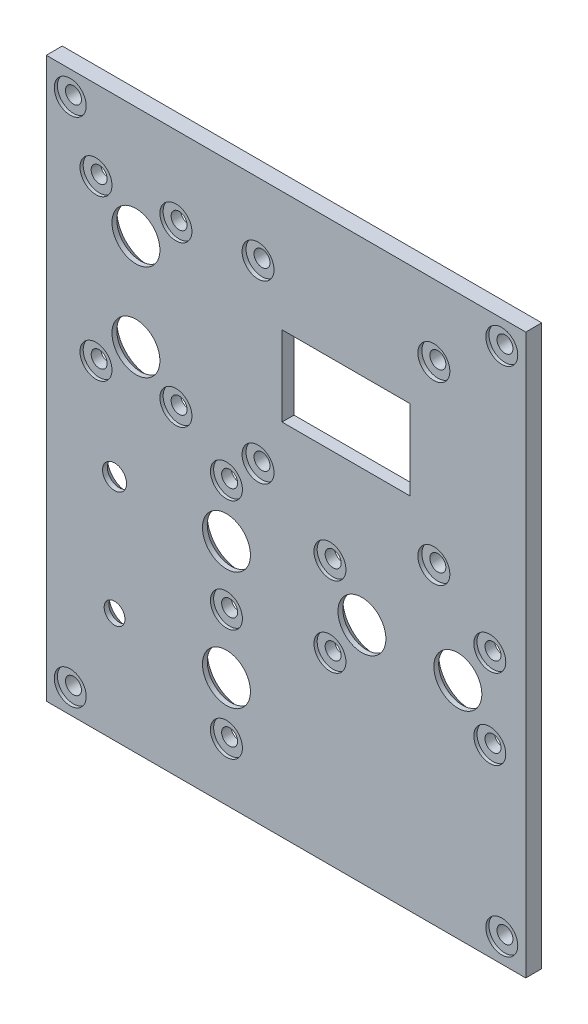
from build123d import *

# Parameters (mm, degrees)
Y_KSEKLIK_EKSTR_ZYON2_DEPTH      = 2
KES_EKSTR_ZYON3_DEPTH            = 2
IZIM3_5_W                        = 16
IZIM3_5_H                        = 10
KES_EKSTR_ZYON6_DEPTH            = 0.5
IZIM3_6_R                        = 1
KES_EKSTR_ZYON7_DEPTH            = 2
OLED_EKRAN_VIDA_R                = 2
KES_EKSTR_ZYON8_DEPTH            = 0.5
KES_EKSTR_ZYON16_DEPTH           = 89.481636513
KES_EKSTR_ZYON16_DEPTH_BACK      = 2
TUS_TAK_M_R                      = 3
TUS_TAK_M_R_2                    = 1
IZIM21_W                         = 23
IZIM21_H                         = 13
IZIM21_R                         = 1
IZIM21_R_2                       = 3
KES_EKSTR_ZYON17_DEPTH           = 0.4
KES_EKSTR_ZYON17_DRAFT           = 20
IZIM21_W_2                       = 13
IZIM21_H_2                       = 23
KES_EKSTR_ZYON17_PROFILE_2_DEPTH = 0.4
KES_EKSTR_ZYON17_PROFILE_2_DRAFT = 20
TUS_TAK_M_9_R                    = 2
TUS_TAK_M_9_R_2                  = 1
KES_EKSTR_ZYON18_DEPTH           = 0.4
POTANSIYOMETRE_TUS_R             = 3
POTANSIYOMETRE_TUS_R_2           = 1.5
POTANSIYOMETRE_TUS_R_3           = 1.300820531
POTANSIYOMETRE_TUS_R_4           = 1
KES_EKSTR_ZYON19_DEPTH           = 2
POTANSIYOMETRE_TUS_3_R           = 2
POTANSIYOMETRE_TUS_3_R_2         = 1
KES_EKSTR_ZYON20_DEPTH           = 0.4
IZIM24_W                         = 16
IZIM24_H                         = 32
IZIM24_R                         = 1
IZIM24_R_2                       = 3
KES_EKSTR_ZYON21_DEPTH           = 0.4
KES_EKSTR_ZYON21_DRAFT           = 20
IZIM24_R_3                       = 5
IZIM24_R_4                       = 1.5
KES_EKSTR_ZYON21_PROFILE_2_DEPTH = 0.4
KES_EKSTR_ZYON21_PROFILE_2_DRAFT = 20
IZIM24_R_5                       = 1.300820531
KES_EKSTR_ZYON21_PROFILE_3_DEPTH = 0.4
KES_EKSTR_ZYON21_PROFILE_3_DRAFT = 20
SASE_VIDA_R                      = 1
KES_EKSTR_ZYON22_DEPTH           = 2
SASE_VIDA_3_R                    = 2
SASE_VIDA_3_R_2                  = 1
KES_EKSTR_ZYON23_DEPTH           = 0.4
RADYUS3_SIZE                     = 1


with BuildPart() as part:
    # genel_sase → Yükseklik-Ekstrüzyon2 (new body)
    with BuildSketch(Plane.XY):
        Polygon((0, 0), (0, 65), (60, 65), (60, -2), (60, -5), (0, -5), align=None)
    extrude(amount=Y_KSEKLIK_EKSTR_ZYON2_DEPTH)

    # oled_yuva → Kes-Ekstrüzyon3 (cut)
    with BuildSketch(Plane(origin=(0, 0, 0), x_dir=(-1, 0, 0), z_dir=(0, 0, -1))):
        Polygon((-29.5, 50), (-37.5, 50), (-45.5, 50), (-45.5, 45), (-45.5, 40), (-37.5, 40), (-29.5, 40), (-29.5, 45), align=None)
    extrude(amount=-KES_EKSTR_ZYON3_DEPTH, mode=Mode.SUBTRACT)

    # Çizim3<5> → Kes-Ekstrüzyon6 (cut)
    with BuildSketch(Plane(origin=(0, 0, 0), x_dir=(-1, 0, 0), z_dir=(0, 0, -1))):
        with BuildLine():
            Line((-28, 56), (-47, 56))
            ThreePointArc((-47, 56), (-47.439339828, 54.939339828), (-48.5, 54.5))
            Line((-48.5, 54.5), (-48.5, 35.5))
            ThreePointArc((-48.5, 35.5), (-47.439339828, 35.060660172), (-47, 34))
            Line((-47, 34), (-28, 34))
            ThreePointArc((-28, 34), (-27.560660172, 35.060660172), (-26.5, 35.5))
            Line((-26.5, 35.5), (-26.5, 54.5))
            ThreePointArc((-26.5, 54.5), (-27.560660172, 54.939339828), (-28, 56))
        make_face()
        with Locations((-37.5, 45)):
            Rectangle(IZIM3_5_W, IZIM3_5_H, mode=Mode.SUBTRACT)
    extrude(amount=-KES_EKSTR_ZYON6_DEPTH, mode=Mode.SUBTRACT)

    # Çizim3<6> → Kes-Ekstrüzyon7 (cut)
    with BuildSketch(Plane(origin=(0, 0, 0), x_dir=(-1, 0, 0), z_dir=(0, 0, -1))):
        with Locations((-48.5, 56)):
            Circle(IZIM3_6_R)
        with Locations((-48.5, 34)):
            Circle(IZIM3_6_R)
        with Locations((-26.5, 56)):
            Circle(IZIM3_6_R)
        with Locations((-26.5, 34)):
            Circle(IZIM3_6_R)
    extrude(amount=-KES_EKSTR_ZYON7_DEPTH, mode=Mode.SUBTRACT)

    # oled_ekran_vida → Kes-Ekstrüzyon8 (cut)
    with BuildSketch(Plane.XY.offset(2)):
        with Locations((26.5, 56)):
            Circle(OLED_EKRAN_VIDA_R)
        with Locations((48.5, 56)):
            Circle(OLED_EKRAN_VIDA_R)
        with Locations((26.5, 34)):
            Circle(OLED_EKRAN_VIDA_R)
        with Locations((48.5, 34)):
            Circle(OLED_EKRAN_VIDA_R)
    extrude(amount=-KES_EKSTR_ZYON8_DEPTH, mode=Mode.SUBTRACT)

    # tus_takım → Kes-Ekstrüzyon16 (cut, two sides: drawn at the far end of the back side and taken through both)
    with BuildSketch(Plane.XY.offset(2).offset(-KES_EKSTR_ZYON16_DEPTH_BACK)):
        with Locations((11.222019684, 51)):
            Circle(TUS_TAK_M_R)
        with Locations((11.222019684, 39)):
            Circle(TUS_TAK_M_R)
        with Locations((16.222019684, 55)):
            Circle(TUS_TAK_M_R_2)
        with Locations((6.222019684, 55)):
            Circle(TUS_TAK_M_R_2)
        with Locations((16.222019684, 35)):
            Circle(TUS_TAK_M_R_2)
        with Locations((6.222019684, 35)):
            Circle(TUS_TAK_M_R_2)
        with Locations((35.5, 18)):
            Circle(TUS_TAK_M_R_2)
        with Locations((39.5, 23)):
            Circle(TUS_TAK_M_R)
        with Locations((55.5, 18)):
            Circle(TUS_TAK_M_R_2)
        with Locations((55.5, 28)):
            Circle(TUS_TAK_M_R_2)
        with Locations((35.5, 28)):
            Circle(TUS_TAK_M_R_2)
        with Locations((51.5, 23)):
            Circle(TUS_TAK_M_R)
    extrude(amount=KES_EKSTR_ZYON16_DEPTH + KES_EKSTR_ZYON16_DEPTH_BACK, mode=Mode.SUBTRACT)


with BuildPart() as kes_ekstr_zyon17_tool:
    # Çizim21 → Kes-Ekstrüzyon17 (with draft: the straight prism first)
    with BuildSketch(Plane(origin=(0, 0, 0), x_dir=(-1, 0, 0), z_dir=(0, 0, -1))):
        with Locations((-45.5, 23)):
            Rectangle(IZIM21_W, IZIM21_H)
        with Locations((-55.5, 18)):
            Circle(IZIM21_R, mode=Mode.SUBTRACT)
        with Locations((-51.5, 23)):
            Circle(IZIM21_R_2, mode=Mode.SUBTRACT)
        with Locations((-35.5, 18)):
            Circle(IZIM21_R, mode=Mode.SUBTRACT)
        with Locations((-39.5, 23)):
            Circle(IZIM21_R_2, mode=Mode.SUBTRACT)
        with Locations((-55.5, 28)):
            Circle(IZIM21_R, mode=Mode.SUBTRACT)
        with Locations((-35.5, 28)):
            Circle(IZIM21_R, mode=Mode.SUBTRACT)
    extrude(amount=-KES_EKSTR_ZYON17_DEPTH)
    # Kes-Ekstrüzyon17: the draft: its side faces are tilted about the plane it starts from
    kes_ekstr_zyon17_sides = [kes_ekstr_zyon17_tool.faces().sort_by_distance(p)[0] for p in [
        (34, 23, 0.2),
        (45.5, 29.5, 0.2),
        (57, 23, 0.2),
        (45.5, 16.5, 0.2),
        (56.5, 18, 0.2),
        (54.5, 23, 0.2),
        (36.5, 18, 0.2),
        (42.5, 23, 0.2),
        (56.5, 28, 0.2),
        (36.5, 28, 0.2),
    ]]
    draft(kes_ekstr_zyon17_sides, Plane(origin=(0, 0, 0), x_dir=(-1, 0, 0), z_dir=(0, 0, -1)), KES_EKSTR_ZYON17_DRAFT)


with BuildPart() as part_1:
    add(part.part)

    # Kes-Ekstrüzyon17: cut by kes_ekstr_zyon17_tool
    add(kes_ekstr_zyon17_tool.part, mode=Mode.SUBTRACT)


with BuildPart() as kes_ekstr_zyon17_profile_2_tool:
    # Çizim21 → Kes-Ekstrüzyon17 profile 2 (with draft: the straight prism first)
    with BuildSketch(Plane(origin=(0, 0, 0), x_dir=(-1, 0, 0), z_dir=(0, 0, -1))):
        with Locations((-11.222019684, 45)):
            Rectangle(IZIM21_W_2, IZIM21_H_2)
        with Locations((-16.222019684, 35)):
            Circle(IZIM21_R, mode=Mode.SUBTRACT)
        with Locations((-6.222019684, 35)):
            Circle(IZIM21_R, mode=Mode.SUBTRACT)
        with Locations((-11.222019684, 39)):
            Circle(IZIM21_R_2, mode=Mode.SUBTRACT)
        with Locations((-11.222019684, 51)):
            Circle(IZIM21_R_2, mode=Mode.SUBTRACT)
        with Locations((-16.222019684, 55)):
            Circle(IZIM21_R, mode=Mode.SUBTRACT)
        with Locations((-6.222019684, 55)):
            Circle(IZIM21_R, mode=Mode.SUBTRACT)
    extrude(amount=-KES_EKSTR_ZYON17_PROFILE_2_DEPTH)
    # Kes-Ekstrüzyon17 profile 2: the draft: its side faces are tilted about the plane it starts from
    kes_ekstr_zyon17_profile_2_sides = [kes_ekstr_zyon17_profile_2_tool.faces().sort_by_distance(p)[0] for p in [
        (11.222019684, 56.5, 0.2),
        (17.722019684, 45, 0.2),
        (11.222019684, 33.5, 0.2),
        (4.722019684, 45, 0.2),
        (17.222019684, 35, 0.2),
        (7.222019684, 35, 0.2),
        (14.222019684, 39, 0.2),
        (14.222019684, 51, 0.2),
        (17.222019684, 55, 0.2),
        (7.222019684, 55, 0.2),
    ]]
    draft(kes_ekstr_zyon17_profile_2_sides, Plane(origin=(0, 0, 0), x_dir=(-1, 0, 0), z_dir=(0, 0, -1)), KES_EKSTR_ZYON17_PROFILE_2_DRAFT)


with BuildPart() as part_2:
    add(part_1.part)

    # Kes-Ekstrüzyon17 profile 2: cut by kes_ekstr_zyon17_profile_2_tool
    add(kes_ekstr_zyon17_profile_2_tool.part, mode=Mode.SUBTRACT)

    # tus_takım<9> → Kes-Ekstrüzyon18 (cut)
    # profile 1 of 8: a face of its own
    with BuildSketch(Plane.XY.offset(2)):
        with Locations((16.222019684, 35)):
            Circle(TUS_TAK_M_9_R)
        with Locations((16.222019684, 35)):
            Circle(TUS_TAK_M_9_R_2, mode=Mode.SUBTRACT)
    # profile 2 of 8: a face of its own
    with BuildSketch(Plane.XY.offset(2)):
        with Locations((6.222019684, 35)):
            Circle(TUS_TAK_M_9_R)
        with Locations((6.222019684, 35)):
            Circle(TUS_TAK_M_9_R_2, mode=Mode.SUBTRACT)
    # profile 3 of 8: a face of its own
    with BuildSketch(Plane.XY.offset(2)):
        with Locations((6.222019684, 55)):
            Circle(TUS_TAK_M_9_R)
        with Locations((6.222019684, 55)):
            Circle(TUS_TAK_M_9_R_2, mode=Mode.SUBTRACT)
    # profile 4 of 8: a face of its own
    with BuildSketch(Plane.XY.offset(2)):
        with Locations((16.222019684, 55)):
            Circle(TUS_TAK_M_9_R)
        with Locations((16.222019684, 55)):
            Circle(TUS_TAK_M_9_R_2, mode=Mode.SUBTRACT)
    # profile 5 of 8: a face of its own
    with BuildSketch(Plane.XY.offset(2)):
        with Locations((35.5, 18)):
            Circle(TUS_TAK_M_9_R)
        with Locations((35.5, 18)):
            Circle(TUS_TAK_M_9_R_2, mode=Mode.SUBTRACT)
    # profile 6 of 8: a face of its own
    with BuildSketch(Plane.XY.offset(2)):
        with Locations((35.5, 28)):
            Circle(TUS_TAK_M_9_R)
        with Locations((35.5, 28)):
            Circle(TUS_TAK_M_9_R_2, mode=Mode.SUBTRACT)
    # profile 7 of 8: a face of its own
    with BuildSketch(Plane.XY.offset(2)):
        with Locations((55.5, 18)):
            Circle(TUS_TAK_M_9_R)
        with Locations((55.5, 18)):
            Circle(TUS_TAK_M_9_R_2, mode=Mode.SUBTRACT)
    # profile 8 of 8: a face of its own
    with BuildSketch(Plane.XY.offset(2)):
        with Locations((55.5, 28)):
            Circle(TUS_TAK_M_9_R)
        with Locations((55.5, 28)):
            Circle(TUS_TAK_M_9_R_2, mode=Mode.SUBTRACT)
    extrude(amount=-KES_EKSTR_ZYON18_DEPTH, mode=Mode.SUBTRACT)

    # potansiyometre_tus → Kes-Ekstrüzyon19 (cut)
    with BuildSketch(Plane.XY.offset(2)):
        with Locations((22.544375766, 23.593835479)):
            Circle(POTANSIYOMETRE_TUS_R)
        with Locations((22.544375766, 8.803085337)):
            Circle(POTANSIYOMETRE_TUS_R)
        with Locations((8.544375766, 23.593835479)):
            Circle(POTANSIYOMETRE_TUS_R_2)
        with Locations((8.544375766, 8.803085337)):
            Circle(POTANSIYOMETRE_TUS_R_3)
        with Locations((22.544375766, 16.198460408)):
            Circle(POTANSIYOMETRE_TUS_R_4)
        with Locations((22.544375766, 30.198460408)):
            Circle(POTANSIYOMETRE_TUS_R_4)
        with Locations((22.544375766, 2.198460408)):
            Circle(POTANSIYOMETRE_TUS_R_4)
    extrude(amount=-KES_EKSTR_ZYON19_DEPTH, mode=Mode.SUBTRACT)

    # potansiyometre_tus<3> → Kes-Ekstrüzyon20 (cut)
    # profile 1 of 3: a face of its own
    with BuildSketch(Plane.XY.offset(2)):
        with Locations((22.544375766, 16.198460408)):
            Circle(POTANSIYOMETRE_TUS_3_R)
        with Locations((22.544375766, 16.198460408)):
            Circle(POTANSIYOMETRE_TUS_3_R_2, mode=Mode.SUBTRACT)
    # profile 2 of 3: a face of its own
    with BuildSketch(Plane.XY.offset(2)):
        with Locations((22.544375766, 30.198460408)):
            Circle(POTANSIYOMETRE_TUS_3_R)
        with Locations((22.544375766, 30.198460408)):
            Circle(POTANSIYOMETRE_TUS_3_R_2, mode=Mode.SUBTRACT)
    # profile 3 of 3: a face of its own
    with BuildSketch(Plane.XY.offset(2)):
        with Locations((22.544375766, 2.198460408)):
            Circle(POTANSIYOMETRE_TUS_3_R)
        with Locations((22.544375766, 2.198460408)):
            Circle(POTANSIYOMETRE_TUS_3_R_2, mode=Mode.SUBTRACT)
    extrude(amount=-KES_EKSTR_ZYON20_DEPTH, mode=Mode.SUBTRACT)


with BuildPart() as kes_ekstr_zyon21_tool:
    # Çizim24 → Kes-Ekstrüzyon21 (with draft: the straight prism first)
    with BuildSketch(Plane(origin=(0, 0, 0), x_dir=(-1, 0, 0), z_dir=(0, 0, -1))):
        with Locations((-22.544375766, 16.198460408)):
            Rectangle(IZIM24_W, IZIM24_H)
        with Locations((-22.544375766, 2.198460408)):
            Circle(IZIM24_R, mode=Mode.SUBTRACT)
        with Locations((-22.544375766, 8.803085337)):
            Circle(IZIM24_R_2, mode=Mode.SUBTRACT)
        with Locations((-22.544375766, 16.198460408)):
            Circle(IZIM24_R, mode=Mode.SUBTRACT)
        with Locations((-22.544375766, 23.593835479)):
            Circle(IZIM24_R_2, mode=Mode.SUBTRACT)
        with Locations((-22.544375766, 30.198460408)):
            Circle(IZIM24_R, mode=Mode.SUBTRACT)
    extrude(amount=-KES_EKSTR_ZYON21_DEPTH)
    # Kes-Ekstrüzyon21: the draft: its side faces are tilted about the plane it starts from
    kes_ekstr_zyon21_sides = [kes_ekstr_zyon21_tool.faces().sort_by_distance(p)[0] for p in [
        (22.544375766, 0.198460408, 0.2),
        (14.544375766, 16.198460408, 0.2),
        (22.544375766, 32.198460408, 0.2),
        (30.544375766, 16.198460408, 0.2),
        (23.544375766, 2.198460408, 0.2),
        (25.544375766, 8.803085337, 0.2),
        (23.544375766, 16.198460408, 0.2),
        (25.544375766, 23.593835479, 0.2),
        (23.544375766, 30.198460408, 0.2),
    ]]
    draft(kes_ekstr_zyon21_sides, Plane(origin=(0, 0, 0), x_dir=(-1, 0, 0), z_dir=(0, 0, -1)), KES_EKSTR_ZYON21_DRAFT)


with BuildPart() as part_3:
    add(part_2.part)

    # Kes-Ekstrüzyon21: cut by kes_ekstr_zyon21_tool
    add(kes_ekstr_zyon21_tool.part, mode=Mode.SUBTRACT)


with BuildPart() as kes_ekstr_zyon21_profile_2_tool:
    # Çizim24 → Kes-Ekstrüzyon21 profile 2 (with draft: the straight prism first)
    with BuildSketch(Plane(origin=(0, 0, 0), x_dir=(-1, 0, 0), z_dir=(0, 0, -1))):
        with Locations((-8.544375766, 23.593835479)):
            Circle(IZIM24_R_3)
        with Locations((-8.544375766, 23.593835479)):
            Circle(IZIM24_R_4, mode=Mode.SUBTRACT)
    extrude(amount=-KES_EKSTR_ZYON21_PROFILE_2_DEPTH)
    # Kes-Ekstrüzyon21 profile 2: the draft: its side faces are tilted about the plane it starts from
    kes_ekstr_zyon21_profile_2_sides = [kes_ekstr_zyon21_profile_2_tool.faces().sort_by_distance(p)[0] for p in [
        (13.544375766, 23.593835479, 0.2),
        (10.044375766, 23.593835479, 0.2),
    ]]
    draft(kes_ekstr_zyon21_profile_2_sides, Plane(origin=(0, 0, 0), x_dir=(-1, 0, 0), z_dir=(0, 0, -1)), KES_EKSTR_ZYON21_PROFILE_2_DRAFT)


with BuildPart() as part_4:
    add(part_3.part)

    # Kes-Ekstrüzyon21 profile 2: cut by kes_ekstr_zyon21_profile_2_tool
    add(kes_ekstr_zyon21_profile_2_tool.part, mode=Mode.SUBTRACT)


with BuildPart() as kes_ekstr_zyon21_profile_3_tool:
    # Çizim24 → Kes-Ekstrüzyon21 profile 3 (with draft: the straight prism first)
    with BuildSketch(Plane(origin=(0, 0, 0), x_dir=(-1, 0, 0), z_dir=(0, 0, -1))):
        with Locations((-8.544375766, 8.803085337)):
            Circle(IZIM24_R_3)
        with Locations((-8.544375766, 8.803085337)):
            Circle(IZIM24_R_5, mode=Mode.SUBTRACT)
    extrude(amount=-KES_EKSTR_ZYON21_PROFILE_3_DEPTH)
    # Kes-Ekstrüzyon21 profile 3: the draft: its side faces are tilted about the plane it starts from
    kes_ekstr_zyon21_profile_3_sides = [kes_ekstr_zyon21_profile_3_tool.faces().sort_by_distance(p)[0] for p in [
        (13.544375766, 8.803085337, 0.2),
        (9.845196297, 8.803085337, 0.2),
    ]]
    draft(kes_ekstr_zyon21_profile_3_sides, Plane(origin=(0, 0, 0), x_dir=(-1, 0, 0), z_dir=(0, 0, -1)), KES_EKSTR_ZYON21_PROFILE_3_DRAFT)


with BuildPart() as part_5:
    add(part_4.part)

    # Kes-Ekstrüzyon21 profile 3: cut by kes_ekstr_zyon21_profile_3_tool
    add(kes_ekstr_zyon21_profile_3_tool.part, mode=Mode.SUBTRACT)

    # sase_vida → Kes-Ekstrüzyon22 (cut)
    with BuildSketch(Plane.XY.offset(2)):
        with Locations((3, 62)):
            Circle(SASE_VIDA_R)
        with Locations((3, -2)):
            Circle(SASE_VIDA_R)
        with Locations((57, 62)):
            Circle(SASE_VIDA_R)
        with Locations((57, -2)):
            Circle(SASE_VIDA_R)
    extrude(amount=-KES_EKSTR_ZYON22_DEPTH, mode=Mode.SUBTRACT)

    # sase_vida<3> → Kes-Ekstrüzyon23 (cut)
    # profile 1 of 4: a face of its own
    with BuildSketch(Plane.XY.offset(2)):
        with Locations((3, 62)):
            Circle(SASE_VIDA_3_R)
        with Locations((3, 62)):
            Circle(SASE_VIDA_3_R_2, mode=Mode.SUBTRACT)
    # profile 2 of 4: a face of its own
    with BuildSketch(Plane.XY.offset(2)):
        with Locations((3, -2)):
            Circle(SASE_VIDA_3_R)
        with Locations((3, -2)):
            Circle(SASE_VIDA_3_R_2, mode=Mode.SUBTRACT)
    # profile 3 of 4: a face of its own
    with BuildSketch(Plane.XY.offset(2)):
        with Locations((57, 62)):
            Circle(SASE_VIDA_3_R)
        with Locations((57, 62)):
            Circle(SASE_VIDA_3_R_2, mode=Mode.SUBTRACT)
    # profile 4 of 4: a face of its own
    with BuildSketch(Plane.XY.offset(2)):
        with Locations((57, -2)):
            Circle(SASE_VIDA_3_R)
        with Locations((57, -2)):
            Circle(SASE_VIDA_3_R_2, mode=Mode.SUBTRACT)
    extrude(amount=-KES_EKSTR_ZYON23_DEPTH, mode=Mode.SUBTRACT)

    # Radyus3
    radyus3_edges = [part_5.edges().sort_by_distance(p)[0] for p in [
        (19.544375766, 23.593835479, 0.4),
        (19.544375766, 8.803085337, 0.4),
        (7.044375766, 23.593835479, 0.4),
        (7.243555235, 8.803085337, 0.4),
        (8.222019684, 39, 0.4),
        (8.222019684, 51, 0.4),
        (48.5, 23, 0.4),
        (36.5, 23, 0.4),
    ]]
    chamfer(radyus3_edges, length=RADYUS3_SIZE)


solid = part_5.part
